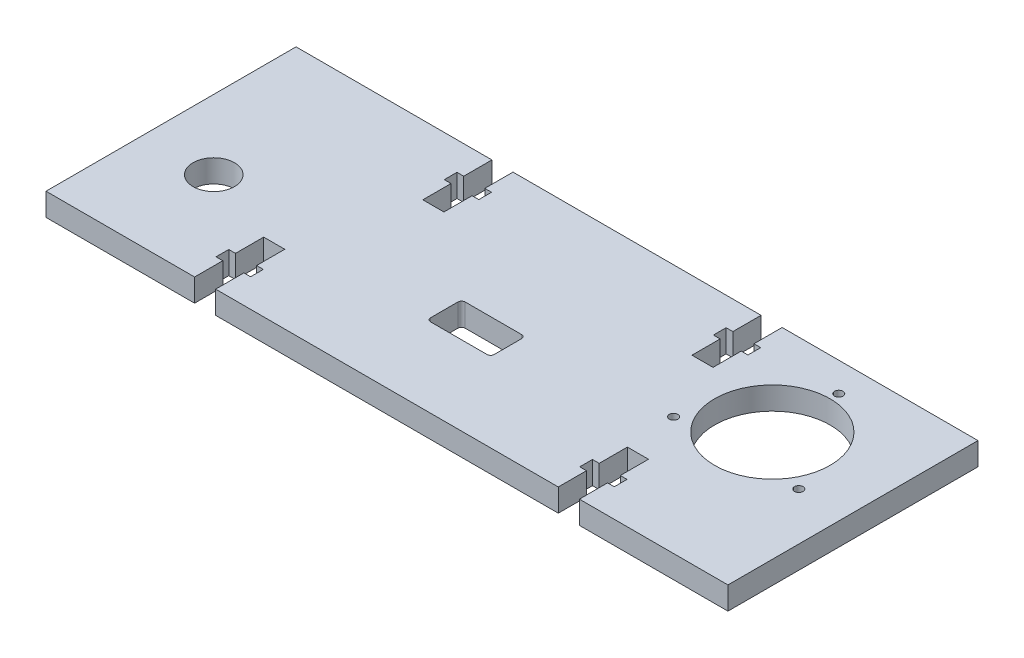
from build123d import *

# Parameters (mm, degrees)
SKETCH1_W                 = 95.25
SKETCH1_H                 = 34.925
BOSS_EXTRUDE1_DEPTH       = 3.175
TAP_DRILL_FOR_0_80_TAP1_D = 1.19126
F_12_CLEARANCE_HOLE1_D    = 5.7912
SKETCH6_W                 = 8.89
SKETCH6_H                 = 4.826
CUT_EXTRUDE1_DEPTH        = 51.824798635
CUT_EXTRUDE3_DEPTH        = 51.824798635
SKETCH9_R                 = 8.0645
CUT_EXTRUDE4_DEPTH        = 51.824798635
FILLET1_R                 = 0.508


with BuildPart() as part:
    # Sketch1 → Boss-Extrude1 (new body)
    with BuildSketch(Plane(origin=(0, 0, 0), x_dir=(1, 0, 0), z_dir=(0, 1, 0))):
        Rectangle(SKETCH1_W, SKETCH1_H)
    extrude(amount=BOSS_EXTRUDE1_DEPTH)

    # Tap Drill for #0-80 Tap1 (through all)
    with Locations(Plane(origin=(0, 3.175, 0), x_dir=(1, 0, 0), z_dir=(0, 1, 0))):
        with Locations((40.97655, -0.920821886), (23.48865, -0.920821886), (32.2326, 13.40485)):
            Hole(TAP_DRILL_FOR_0_80_TAP1_D / 2)

    # #12 Clearance Hole1 (through all)
    with Locations(Plane(origin=(0, 3.175, 0), x_dir=(1, 0, 0), z_dir=(0, 1, 0))):
        with Locations((-37.9095, -3.7465)):
            Hole(F_12_CLEARANCE_HOLE1_D / 2)

    # Sketch6 → Cut-Extrude1 (cut, through all)
    with BuildSketch(Plane(origin=(0, 3.175, 0), x_dir=(1, 0, 0), z_dir=(0, 1, 0))):
        with Locations((-1.016, -4.0005)):
            Rectangle(SKETCH6_W, SKETCH6_H)
    extrude(amount=-CUT_EXTRUDE1_DEPTH, mode=Mode.SUBTRACT)

    # Sketch8 → Cut-Extrude3 (cut, through all)
    with BuildSketch(Plane(origin=(0, 3.175, 0), x_dir=(1, 0, 0), z_dir=(0, 1, 0))):
        Polygon((23.9268, -17.4625), (26.8732, -17.4625), (26.8732, -13.5255), (27.813, -13.5255), (27.813, -11.7475), (26.8732, -11.7475), (26.8732, -7.8105), (23.9268, -7.8105), (23.9268, -11.7475), (22.987, -11.7475), (22.987, -13.5255), (23.9268, -13.5255), align=None)
        Polygon((-26.8732, -17.4625), (-23.9268, -17.4625), (-23.9268, -13.5255), (-22.987, -13.5255), (-22.987, -11.7475), (-23.9268, -11.7475), (-23.9268, -7.8105), (-26.8732, -7.8105), (-26.8732, -11.7475), (-27.813, -11.7475), (-27.813, -13.5255), (-26.8732, -13.5255), align=None)
        Polygon((17.3228, 11.7475), (17.3228, 7.8105), (20.2692, 7.8105), (20.2692, 11.7475), (21.209, 11.7475), (21.209, 13.5255), (20.2692, 13.5255), (20.2692, 17.4625), (17.3228, 17.4625), (17.3228, 13.5255), (16.383, 13.5255), (16.383, 11.7475), align=None)
        Polygon((-20.2692, 11.7475), (-20.2692, 7.8105), (-17.3228, 7.8105), (-17.3228, 11.7475), (-16.383, 11.7475), (-16.383, 13.5255), (-17.3228, 13.5255), (-17.3228, 17.4625), (-20.2692, 17.4625), (-20.2692, 13.5255), (-21.209, 13.5255), (-21.209, 11.7475), align=None)
    extrude(amount=-CUT_EXTRUDE3_DEPTH, mode=Mode.SUBTRACT)

    # Sketch9 → Cut-Extrude4 (cut, through all)
    with BuildSketch(Plane(origin=(0, 3.175, 0), x_dir=(1, 0, 0), z_dir=(0, 1, 0))):
        with Locations((32.2326, 4.1275)):
            Circle(SKETCH9_R)
    extrude(amount=-CUT_EXTRUDE4_DEPTH, mode=Mode.SUBTRACT)

    # Fillet1
    fillet1_edges = [part.edges().sort_by_distance(p)[0] for p in [
        (3.429, 1.5875, 1.5875),
        (-5.461, 1.5875, 1.5875),
        (-5.461, 1.5875, 6.4135),
        (3.429, 1.5875, 6.4135),
    ]]
    fillet(fillet1_edges, radius=FILLET1_R)


solid = part.part
